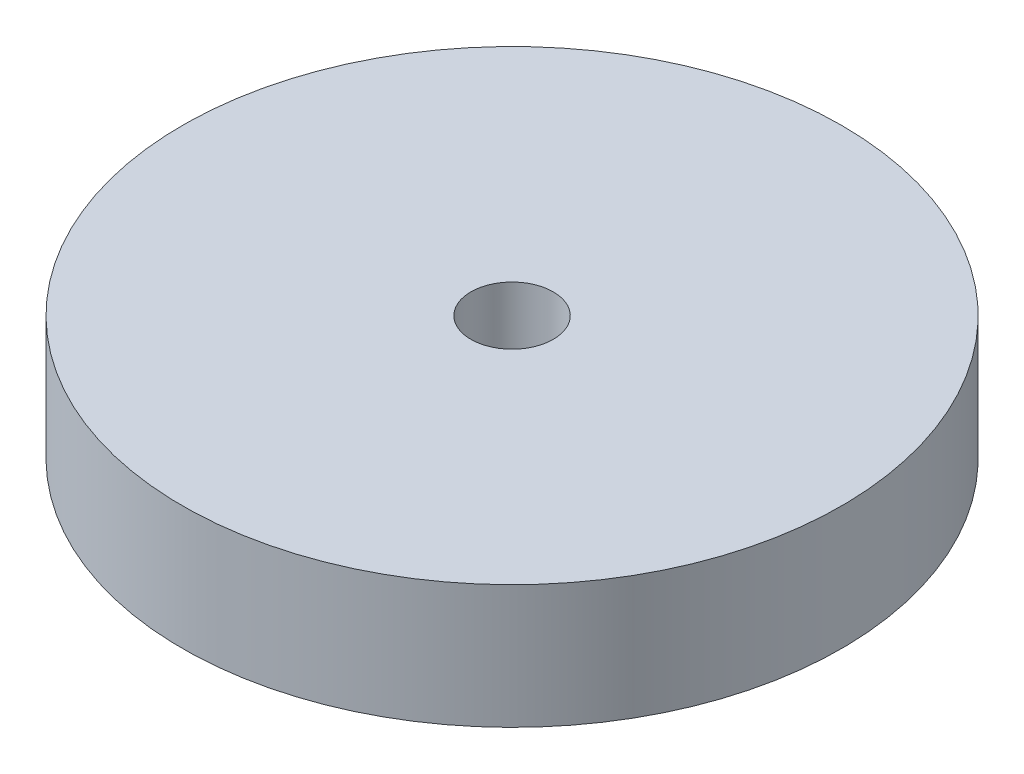
from build123d import *

# Parameters (mm, degrees)
SKETCH1_R           = 25.4
SKETCH1_R_2         = 3.175
BOSS_EXTRUDE1_DEPTH = 9.525


with BuildPart() as part:
    # Sketch1 → Boss-Extrude1 (new body)
    with BuildSketch(Plane(origin=(0, 0, 0), x_dir=(1, 0, 0), z_dir=(0, 1, 0))):
        Circle(SKETCH1_R)
        Circle(SKETCH1_R_2, mode=Mode.SUBTRACT)
    extrude(amount=BOSS_EXTRUDE1_DEPTH)


solid = part.part
